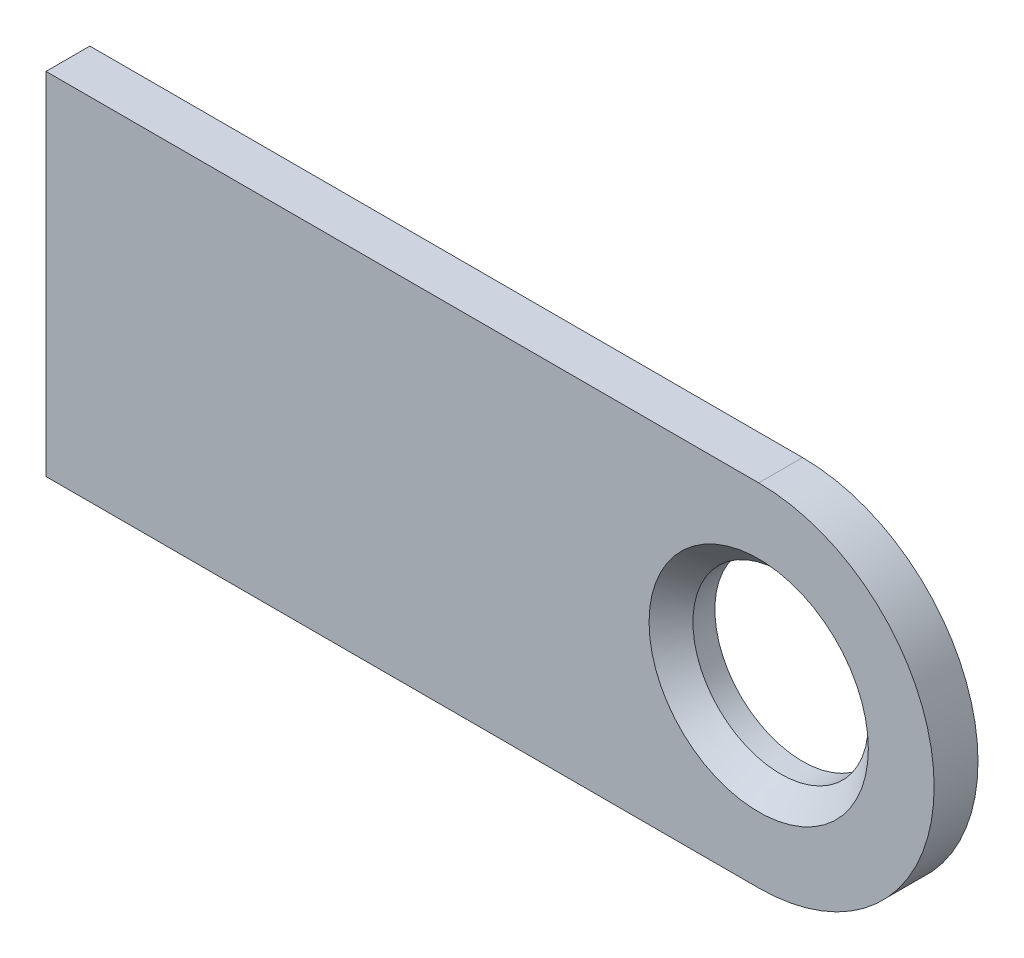
from build123d import *

# Parameters (mm, degrees)
SKETCH_1_R             = 8
SM_BASE_FLANGE_1_DEPTH = 4
CHAMFER_1_SIZE         = 2


# Sheet-metal steps are written as plain solids
with BuildPart() as part:
    # Sketch 1 → Базовая кромка1 (new body)
    with BuildSketch(Plane.XY):
        with BuildLine():
            Line((0, 16), (-65, 16))
            Line((-65, 16), (-65, -16))
            Line((-65, -16), (0, -16))
            ThreePointArc((0, -16), (16, 0), (0, 16))
        make_face()
        Circle(SKETCH_1_R, mode=Mode.SUBTRACT)
    extrude(amount=SM_BASE_FLANGE_1_DEPTH)

    # Фаска1
    chamfer_1_edges = [part.edges().sort_by_distance(p)[0] for p in [
        (-8, 0, 4),
    ]]
    chamfer(chamfer_1_edges, length=CHAMFER_1_SIZE)


solid = part.part
